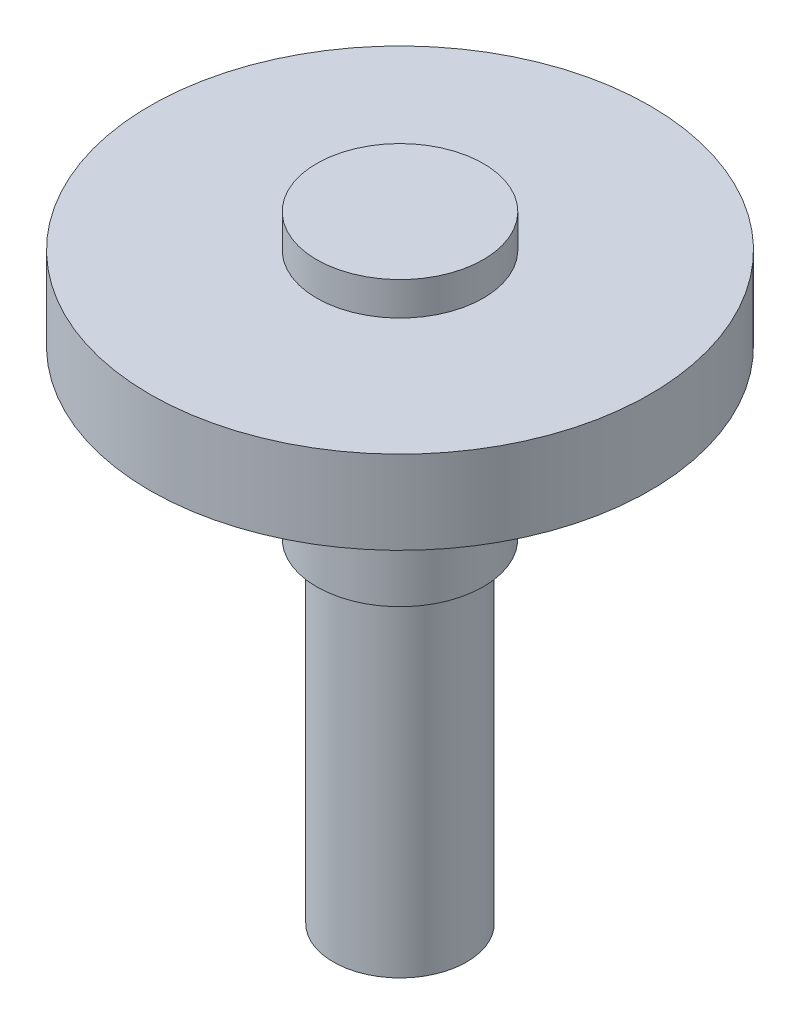
from build123d import *

# Parameters (mm, degrees)
SKETCH1_R           = 15
BOSS_EXTRUDE1_DEPTH = 5
SKETCH3_R           = 5
BOSS_EXTRUDE2_DEPTH = 2
BOSS_EXTRUDE3_START = 10
SKETCH2_R           = 5
BOSS_EXTRUDE3_DEPTH = 10
SKETCH4_R           = 4
BOSS_EXTRUDE4_DEPTH = 20


with BuildPart() as part:
    # Sketch1 → Boss-Extrude1 (new body)
    with BuildSketch(Plane(origin=(0, 0, 0), x_dir=(1, 0, 0), z_dir=(0, 1, 0))):
        Circle(SKETCH1_R)
    extrude(amount=BOSS_EXTRUDE1_DEPTH)

    # Sketch3 → Boss-Extrude2 (add)
    with BuildSketch(Plane(origin=(0, 5, 0), x_dir=(1, 0, 0), z_dir=(0, 1, 0))):
        Circle(SKETCH3_R)
    extrude(amount=BOSS_EXTRUDE2_DEPTH)

    # Sketch2 → Boss-Extrude3 (add)
    with BuildSketch(Plane.XZ.offset(BOSS_EXTRUDE3_START)):
        Circle(SKETCH2_R)
    extrude(amount=-BOSS_EXTRUDE3_DEPTH)

    # Sketch4 → Boss-Extrude4 (add)
    with BuildSketch(Plane.XZ.offset(10)):
        Circle(SKETCH4_R)
    extrude(amount=BOSS_EXTRUDE4_DEPTH)


solid = part.part
